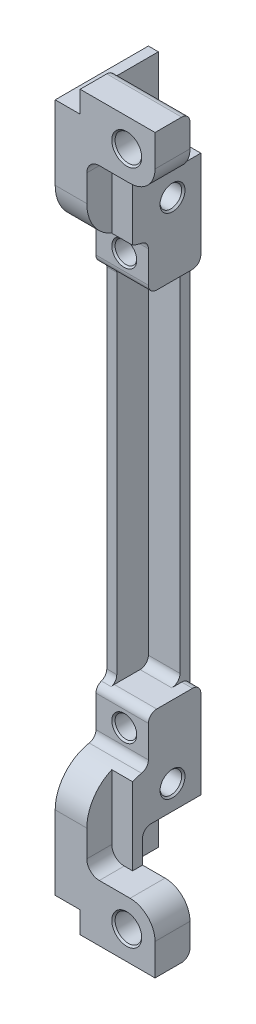
from build123d import *

# Parameters (mm, degrees)
SALIENTE_EXTRUIR1_DEPTH                              = 1.3
SALIENTE_EXTRUIR2_DEPTH                              = 3.8
CORTAR_EXTRUIR1_DEPTH                                = 1.3
SALIENTE_EXTRUIR3_START                              = 1.3
SALIENTE_EXTRUIR3_DEPTH                              = 1.3
CROQUIS14_W                                          = 5.1
CROQUIS14_H                                          = 11.2
SALIENTE_EXTRUIR4_DEPTH                              = 8.901695159
CROQUIS15_W                                          = 5.1
CROQUIS15_H                                          = 11.2
SALIENTE_EXTRUIR5_DEPTH                              = 8.901695176
CROQUIS22_W                                          = 3.8
CROQUIS22_H                                          = 43.6
CORTAR_EXTRUIR2_DEPTH                                = 0.3
SALIENTE_EXTRUIR6_DEPTH                              = 1.2
CROQUIS31_W                                          = 4.2
CROQUIS31_H                                          = 5.4
SALIENTE_EXTRUIR7_DEPTH                              = 3.5
CROQUIS32_W                                          = 7
CROQUIS32_H                                          = 8
CORTAR_EXTRUIR3_DEPTH                                = 5.1
CROQUIS41_W                                          = 6.8
CROQUIS41_H                                          = 4.2
SALIENTE_EXTRUIR8_DEPTH                              = 1.4
CROQUIS42_W                                          = 3.3
CROQUIS42_H                                          = 4.2
SALIENTE_EXTRUIR9_DEPTH                              = 2.6
CROQUIS43_W                                          = 5.1
CROQUIS43_H                                          = 7
CORTAR_EXTRUIR4_DEPTH                                = 8
CROQUIS48_W                                          = 4.2
CROQUIS48_H                                          = 6.8
SALIENTE_EXTRUIR10_DEPTH                             = 5.7
CORTAR_EXTRUIR5_REACH                                = 87.637
CROQUIS58_W                                          = 3.8
CROQUIS58_H                                          = 43.6
CORTAR_EXTRUIR6_REACH                                = 83.667
CROQUIS80_W                                          = 2.5
CROQUIS80_H                                          = 3
CORTAR_EXTRUIR7_REACH                                = 83.667
CROQUIS93_W                                          = 2.5
CROQUIS93_H                                          = 3
AVELLANADO_PARA_TORNILLO_CON_CABEZA_PLAN_D           = 3.8
AVELLANADO_PARA_TORNILLO_CON_CABEZA_PLAN_DEPTH       = 12
AVELLANADO_PARA_TORNILLO_CON_CABEZA_PLAN_CSINK_D     = 5.800283413
AVELLANADO_PARA_TORNILLO_CON_CABEZA_PLAN_CSINK_ANGLE = 90.0028
TALADRO_DE_MARGEN_PARA_21_D                          = 2.6
TALADRO_DE_MARGEN_PARA_22_D                          = 2.6
TALADRO_DE_MARGEN_PARA_22_DEPTH                      = 11.2
TALADRO_DE_MARGEN_PARA_23_D                          = 2.6
AVELLANADO_PARA_TORNILLO_CON_CABEZA_2_D              = 3.2
AVELLANADO_PARA_TORNILLO_CON_CABEZA_2_CSINK_D        = 6.600114174
AVELLANADO_PARA_TORNILLO_CON_CABEZA_2_CSINK_ANGLE    = 90.000991
REDONDEO1_R                                          = 3
CHAFL_N1_SIZE2                                       = 0.19999984
CHAFL_N1_SIZE                                        = 0.199999815
CORTAR_EXTRUIR8_OUTLINE_R                            = 1.3
CORTAR_EXTRUIR8_OUTLINE_R_2                          = 1.9
CORTAR_EXTRUIR8_DEPTH                                = 13
CORTAR_EXTRUIR8_START                                = 5
CORTAR_EXTRUIR8_2_DEPTH                              = 1.3
CORTAR_EXTRUIR8_3_DEPTH                              = 5
CORTAR_EXTRUIR8_4_DEPTH                              = 1.3
CORTAR_EXTRUIR8_START_2                              = 7
CORTAR_EXTRUIR8_5_DEPTH                              = 4.2


with BuildPart() as part:
    # Croquis1 → Saliente-Extruir1 (new body)
    with BuildSketch(Plane(origin=(6.3, 0, 0), x_dir=(0, 0, -1), z_dir=(1, 0, 0))):
        with BuildLine():
            Line((-11.2, 8.901695159), (0, 8.901695159))
            Line((0, 8.901695159), (0, 73.898304841))
            Line((0, 73.898304841), (-11.2, 73.898304841))
            ThreePointArc((-11.2, 73.898304841), (-9.770714214, 70.398304841), (-6.3, 68.899304941))
            Line((-6.3, 68.899304941), (-6.3, 64.2))
            ThreePointArc((-6.3, 64.2), (-6.007106781, 63.492893219), (-5.3, 63.2))
            Line((-5.3, 63.2), (-5.3, 19.6))
            ThreePointArc((-5.3, 19.6), (-6.007106781, 19.307106781), (-6.3, 18.6))
            Line((-6.3, 18.6), (-6.3, 13.900695059))
            ThreePointArc((-6.3, 13.900695059), (-9.770714214, 12.401695159), (-11.2, 8.901695159))
        make_face()
    extrude(amount=-SALIENTE_EXTRUIR1_DEPTH)

    # Croquis6 → Saliente-Extruir2 (add)
    with BuildSketch(Plane.ZY.offset(-5)):
        with BuildLine():
            Line((0, 73.898304841), (11.2, 73.898304841))
            ThreePointArc((11.2, 73.898304841), (9.770714214, 70.398304841), (6.3, 68.899304941))
            Line((6.3, 68.899304941), (6.3, 64.2))
            ThreePointArc((6.3, 64.2), (6.007106781, 63.492893219), (5.3, 63.2))
            Line((5.3, 63.2), (5.3, 19.6))
            ThreePointArc((5.3, 19.6), (6.007106781, 19.307106781), (6.3, 18.6))
            Line((6.3, 18.6), (6.3, 13.900695059))
            ThreePointArc((6.3, 13.900695059), (9.770714214, 12.401695159), (11.2, 8.901695159))
            Line((11.2, 8.901695159), (0, 8.901695159))
            Line((0, 8.901695159), (0, 73.898304841))
        make_face()
    extrude(amount=SALIENTE_EXTRUIR2_DEPTH)

    # Croquis7 → Cortar-Extruir1 (cut)
    with BuildSketch(Plane(origin=(6.3, 0, 0), x_dir=(0, 0, -1), z_dir=(1, 0, 0))):
        with BuildLine():
            Line((-5.3, 19.6), (0, 19.6))
            Line((0, 19.6), (0, 73.898304841))
            Line((0, 73.898304841), (-11.2, 73.898304841))
            ThreePointArc((-11.2, 73.898304841), (-9.770714214, 70.398304841), (-6.3, 68.899304941))
            Line((-6.3, 68.899304941), (-6.3, 64.2))
            ThreePointArc((-6.3, 64.2), (-6.007106781, 63.492893219), (-5.3, 63.2))
            Line((-5.3, 63.2), (-5.3, 19.6))
        make_face()
    extrude(amount=-CORTAR_EXTRUIR1_DEPTH, mode=Mode.SUBTRACT)

    # Croquis8 → Saliente-Extruir3 (add)
    with BuildSketch(Plane(origin=(5, 0, 0), x_dir=(0, 0, -1), z_dir=(1, 0, 0)).offset(SALIENTE_EXTRUIR3_START)):
        with BuildLine():
            Line((0, 73.898304841), (0, 63.2))
            Line((0, 63.2), (-5.3, 63.2))
            ThreePointArc((-5.3, 63.2), (-6.007106781, 63.492893219), (-6.3, 64.2))
            Line((-6.3, 64.2), (-6.3, 68.899304941))
            ThreePointArc((-6.3, 68.899304941), (-9.770714214, 70.398304841), (-11.2, 73.898304841))
            Line((-11.2, 73.898304841), (0, 73.898304841))
        make_face()
    extrude(amount=-SALIENTE_EXTRUIR3_DEPTH)

    # Croquis14 → Saliente-Extruir4 (add)
    with BuildSketch(Plane(origin=(0, 73.898304841, 0), x_dir=(1, 0, 0), z_dir=(0, 1, 0))):
        with Locations((3.75, -5.6)):
            Rectangle(CROQUIS14_W, CROQUIS14_H)
    extrude(amount=SALIENTE_EXTRUIR4_DEPTH)

    # Croquis15 → Saliente-Extruir5 (add)
    with BuildSketch(Plane.XZ.offset(-8.901695159)):
        with Locations((3.75, 5.6)):
            Rectangle(CROQUIS15_W, CROQUIS15_H)
    extrude(amount=SALIENTE_EXTRUIR5_DEPTH)

    # Croquis22 → Cortar-Extruir2 (cut)
    with BuildSketch(Plane.XY.offset(5.3)):
        with Locations((3.1, 41.4)):
            Rectangle(CROQUIS22_W, CROQUIS22_H)
    extrude(amount=-CORTAR_EXTRUIR2_DEPTH, mode=Mode.SUBTRACT)

    # Croquis30 → Saliente-Extruir6 (add)
    with BuildSketch(Plane.ZY.offset(-1.2)):
        with BuildLine():
            Line((6.3, 68.899304941), (6.3, 64.2))
            ThreePointArc((6.3, 64.2), (6.121583836, 63.629912287), (5.65, 63.2632503))
            ThreePointArc((5.65, 63.2632503), (5.178416164, 62.896588313), (5, 62.3265006))
            Line((5, 62.3265006), (5, 20.4734994))
            ThreePointArc((5, 20.4734994), (5.178416164, 19.903411687), (5.65, 19.5367497))
            ThreePointArc((5.65, 19.5367497), (6.121583836, 19.170087713), (6.3, 18.6))
            Line((6.3, 18.6), (6.3, 13.900695059))
            ThreePointArc((6.3, 13.900695059), (9.770714214, 12.401695159), (11.2, 8.901695159))
            Line((11.2, 8.901695159), (11.2, 0))
            Line((11.2, 0), (0, 0))
            Line((0, 0), (0, 82.8))
            Line((0, 82.8), (11.2, 82.8))
            Line((11.2, 82.8), (11.2, 73.898304841))
            ThreePointArc((11.2, 73.898304841), (9.770714214, 70.398304841), (6.3, 68.899304941))
        make_face()
    extrude(amount=SALIENTE_EXTRUIR6_DEPTH)

    # Croquis31 → Saliente-Extruir7 (add)
    with BuildSketch(Plane(origin=(6.3, 0, 0), x_dir=(0, 0, -1), z_dir=(1, 0, 0))):
        with Locations((-9.1, 80.1)):
            Rectangle(CROQUIS31_W, CROQUIS31_H)
    extrude(amount=SALIENTE_EXTRUIR7_DEPTH)

    # Croquis32 → Cortar-Extruir3 (cut)
    with BuildSketch(Plane(origin=(6.3, 0, 0), x_dir=(0, 0, -1), z_dir=(1, 0, 0))):
        with Locations((-3.5, 78.8)):
            Rectangle(CROQUIS32_W, CROQUIS32_H)
    extrude(amount=-CORTAR_EXTRUIR3_DEPTH, mode=Mode.SUBTRACT)

    # Croquis41 → Saliente-Extruir8 (add)
    with BuildSketch(Plane(origin=(0, 82.8, 0), x_dir=(1, 0, 0), z_dir=(0, 1, 0))):
        with Locations((6.4, -9.1)):
            Rectangle(CROQUIS41_W, CROQUIS41_H)
    extrude(amount=SALIENTE_EXTRUIR8_DEPTH)

    # Croquis42 → Saliente-Extruir9 (add)
    with BuildSketch(Plane.XZ):
        with Locations((4.65, 9.1)):
            Rectangle(CROQUIS42_W, CROQUIS42_H)
    extrude(amount=SALIENTE_EXTRUIR9_DEPTH)

    # Croquis43 → Cortar-Extruir4 (cut)
    with BuildSketch(Plane.XZ):
        with Locations((3.75, 3.5)):
            Rectangle(CROQUIS43_W, CROQUIS43_H)
    extrude(amount=-CORTAR_EXTRUIR4_DEPTH, mode=Mode.SUBTRACT)

    # Croquis48 → Saliente-Extruir10 (add)
    with BuildSketch(Plane(origin=(6.3, 0, 0), x_dir=(0, 0, -1), z_dir=(1, 0, 0))):
        with Locations((-9.1, 0.8)):
            Rectangle(CROQUIS48_W, CROQUIS48_H)
    extrude(amount=SALIENTE_EXTRUIR10_DEPTH)

    # Croquis58 → Cortar-Extruir5 (cut, up to next)
    with BuildSketch(Plane(origin=(0, 0, 1.2), x_dir=(-1, 0, 0), z_dir=(0, 0, -1)), mode=Mode.PRIVATE) as cortar_extruir5_sk1:
        with Locations((-3.1, 41.4)):
            Rectangle(CROQUIS58_W, CROQUIS58_H)
    cortar_extruir5_tool1 = extrude(cortar_extruir5_sk1.sketch, amount=-CORTAR_EXTRUIR5_REACH, mode=Mode.PRIVATE) & part.part
    add(cortar_extruir5_tool1.solids().sort_by_distance((3.1, 41.4, 1.2))[0], mode=Mode.SUBTRACT)

    # Croquis80 → Cortar-Extruir6 (cut, up to next)
    with BuildSketch(Plane(origin=(0, 77.4, 0), x_dir=(1, 0, 0), z_dir=(0, 1, 0)), mode=Mode.PRIVATE) as cortar_extruir6_sk1:
        with Locations((5.05, -9.7)):
            Rectangle(CROQUIS80_W, CROQUIS80_H)
    cortar_extruir6_tool1 = extrude(cortar_extruir6_sk1.sketch, amount=-CORTAR_EXTRUIR6_REACH, mode=Mode.PRIVATE) & part.part
    add(cortar_extruir6_tool1.solids().sort_by_distance((5.05, 77.4, 9.7))[0], mode=Mode.SUBTRACT)

    # Croquis93 → Cortar-Extruir7 (cut, up to next)
    with BuildSketch(Plane(origin=(0, 4.2, 0), x_dir=(-1, 0, 0), z_dir=(0, -1, 0)), mode=Mode.PRIVATE) as cortar_extruir7_sk1:
        with Locations((-5.05, -9.7)):
            Rectangle(CROQUIS93_W, CROQUIS93_H)
    cortar_extruir7_tool1 = extrude(cortar_extruir7_sk1.sketch, amount=-CORTAR_EXTRUIR7_REACH, mode=Mode.PRIVATE) & part.part
    add(cortar_extruir7_tool1.solids().sort_by_distance((5.05, 4.2, 9.7))[0], mode=Mode.SUBTRACT)

    # Avellanado para tornillo con cabeza plan
    with Locations(Plane.ZY):
        with Locations((4.1, 3.9), (4.1, 78.9)):
            CounterSinkHole(AVELLANADO_PARA_TORNILLO_CON_CABEZA_PLAN_D / 2, AVELLANADO_PARA_TORNILLO_CON_CABEZA_PLAN_CSINK_D / 2, depth=AVELLANADO_PARA_TORNILLO_CON_CABEZA_PLAN_DEPTH, counter_sink_angle=AVELLANADO_PARA_TORNILLO_CON_CABEZA_PLAN_CSINK_ANGLE)

    # Taladro de margen para #21 (through all)
    with Locations(Plane(origin=(6.3, 0, 0), x_dir=(0, 0, -1), z_dir=(1, 0, 0))):
        with Locations((-3.4, 10.9), (-3.4, 71.9)):
            Hole(TALADRO_DE_MARGEN_PARA_21_D / 2)

    # Taladro de margen para #22
    with Locations(Plane(origin=(0, 0, 0), x_dir=(-1, 0, 0), z_dir=(0, 0, -1))):
        with Locations((-3.4, 66.1)):
            Hole(TALADRO_DE_MARGEN_PARA_22_D / 2, depth=TALADRO_DE_MARGEN_PARA_22_DEPTH)

    # Taladro de margen para #23 (through all)
    with Locations(Plane.XY.offset(6.3)):
        with Locations((3.4, 16.7)):
            Hole(TALADRO_DE_MARGEN_PARA_23_D / 2)

    # Avellanado para tornillo con cabeza  2 (through all)
    with Locations(Plane(origin=(0, 0, 7), x_dir=(-1, 0, 0), z_dir=(0, 0, -1))):
        with Locations((-6.4, 80.8), (-8.6, 0.8)):
            CounterSinkHole(AVELLANADO_PARA_TORNILLO_CON_CABEZA_2_D / 2, AVELLANADO_PARA_TORNILLO_CON_CABEZA_2_CSINK_D / 2, counter_sink_angle=AVELLANADO_PARA_TORNILLO_CON_CABEZA_2_CSINK_ANGLE)

    # Redondeo1
    redondeo1_edges = [part.edges().sort_by_distance(p)[0] for p in [
        (9.8, 77.4, 9.1),
        (12, 4.2, 9.1),
    ]]
    fillet(redondeo1_edges, radius=REDONDEO1_R)

    # Chaflán1
    chafl_n1_edges = [part.edges().sort_by_distance(p)[0] for p in [
        (6.3, 71.9, 2.1),
        (6.3, 10.9, 2.1),
        (2.1, 66.1, 6.3),
        (4.7, 16.7, 6.3),
    ]]
    chamfer(chafl_n1_edges, length=CHAFL_N1_SIZE, length2=CHAFL_N1_SIZE2)

    # Cortar-Extruir8: read off the stored shape, not the designer's step
    # Cortar-Extruir8 outline → Cortar-Extruir8 (cut)
    # profile 1 of 2: a face of its own
    with BuildSketch(Plane.YZ):
        with BuildLine():
            Line((-2.6, 7), (-1.6, 7))
            ThreePointArc((-1.6, 7), (-2.307106781, 7.292893219), (-2.6, 8))
            Line((-2.6, 8), (-2.6, 7))
        make_face()
    # profile 2 of 2: a face of its own
    with BuildSketch(Plane.YZ):
        with BuildLine():
            Line((41.402, 0), (82.8, 0))
            Line((82.8, 0), (82.8, 7))
            Line((82.8, 7), (84.2, 7))
            Line((84.2, 7), (84.2, 11.2))
            Line((84.2, 11.2), (73.898304841, 11.2))
            ThreePointArc((73.898304841, 11.2), (70.398304841, 9.770714214), (68.899304941, 6.3))
            Line((68.899304941, 6.3), (64.2, 6.3))
            ThreePointArc((64.2, 6.3), (63.629912288, 6.121583836), (63.2632503, 5.65))
            ThreePointArc((63.2632503, 5.65), (62.896588313, 5.178416164), (62.3265006, 5))
            Line((62.3265006, 5), (41.402, 5))
            Line((41.402, 5), (41.402, 0))
        make_face()
        with Locations((71.9, 3.4)):
            Circle(CORTAR_EXTRUIR8_OUTLINE_R, mode=Mode.SUBTRACT)
        with Locations((78.9, 4.1)):
            Circle(CORTAR_EXTRUIR8_OUTLINE_R_2, mode=Mode.SUBTRACT)
    extrude(amount=CORTAR_EXTRUIR8_DEPTH, mode=Mode.SUBTRACT)

    # Cortar-Extruir8 2 outline → Cortar-Extruir8 2 (cut)
    with BuildSketch(Plane.YZ.offset(CORTAR_EXTRUIR8_START)):
        with BuildLine():
            Line((19.6, 0), (19.6, 1))
            ThreePointArc((19.6, 1), (19.307106781, 0.292893219), (18.6, 0))
            Line((18.6, 0), (19.6, 0))
        make_face()
    extrude(amount=CORTAR_EXTRUIR8_2_DEPTH, mode=Mode.SUBTRACT)

    # Cortar-Extruir8 3 outline → Cortar-Extruir8 3 (add)
    with BuildSketch(Plane.YZ):
        with BuildLine():
            ThreePointArc((14.8, 6.3), (14.16099035, 6.530801283), (13.816949193, 7.116666667))
            ThreePointArc((13.816949193, 7.116666667), (13.875611511, 6.710055017), (13.900695059, 6.3))
            Line((13.900695059, 6.3), (14.8, 6.3))
        make_face()
        with BuildLine():
            ThreePointArc((7, 7), (7.707106781, 6.707106781), (8, 6))
            Line((8, 6), (8, 7))
            Line((8, 7), (7, 7))
        make_face()
        with BuildLine():
            Line((19.6, 2.2), (19.6, 1.2))
            Line((19.6, 1.2), (20.6, 1.2))
            ThreePointArc((20.6, 1.2), (19.892893219, 1.492893219), (19.6, 2.2))
        make_face()
    extrude(amount=CORTAR_EXTRUIR8_3_DEPTH)

    # Cortar-Extruir8 4 outline → Cortar-Extruir8 4 (add)
    with BuildSketch(Plane.YZ.offset(CORTAR_EXTRUIR8_START)):
        with BuildLine():
            ThreePointArc((14.8, 6.3), (14.16099035, 6.530801283), (13.816949193, 7.116666667))
            ThreePointArc((13.816949193, 7.116666667), (13.875611511, 6.710055017), (13.900695059, 6.3))
            Line((13.900695059, 6.3), (14.8, 6.3))
        make_face()
        with BuildLine():
            ThreePointArc((7, 7), (7.707106781, 6.707106781), (8, 6))
            Line((8, 6), (8, 7))
            Line((8, 7), (7, 7))
        make_face()
    extrude(amount=CORTAR_EXTRUIR8_4_DEPTH)

    # Cortar-Extruir8 5 outline → Cortar-Extruir8 5 (add)
    with BuildSketch(Plane.XY.offset(CORTAR_EXTRUIR8_START_2)):
        with BuildLine():
            ThreePointArc((5.3, 4.2), (4.239339828, 4.639339828), (3.8, 5.7))
            Line((3.8, 5.7), (3.8, 4.2))
            Line((3.8, 4.2), (5.3, 4.2))
        make_face()
    extrude(amount=CORTAR_EXTRUIR8_5_DEPTH)

    # Cortar-Extruir8 6 outline → Cortar-Extruir8 6 (revolve, cut)
    with BuildSketch(Plane(origin=(3.4, 16.7, 0), x_dir=(1, 0, 0), z_dir=(0, -1, 0))):
        Polygon((2.30016099, 0), (1.3, 1.000284865), (1.3, 0), align=None)
    revolve(axis=Axis((3.4, 16.7, 0), (0, 0, 1)), mode=Mode.SUBTRACT)

    # Cortar-Extruir8 7 outline → Cortar-Extruir8 7 (revolve, cut)
    with BuildSketch(Plane(origin=(0, 10.9, 3.4), x_dir=(0, 1, 0), z_dir=(0, 0, -1))):
        Polygon((2.30016099, 0), (1.3, 1.000284865), (1.3, 0), align=None)
    revolve(axis=Axis((0, 10.9, 3.4), (1, 0, 0)), mode=Mode.SUBTRACT)

    # Cortar-Extruir8 8 outline → Cortar-Extruir8 8 (revolve, cut)
    with BuildSketch(Plane(origin=(8.6, 0.8, 0), x_dir=(1, 0, 0), z_dir=(0, -1, 0))):
        Polygon((1.6, 11.2), (1.6, 11.000129523), (1.799854298, 11.2), align=None)
    revolve(axis=Axis((8.6, 0.8, 0), (0, 0, 1)), mode=Mode.SUBTRACT)

    # Simetría1: part across plane


with BuildPart() as part_1:
    add(part.part)
    add(part.part.mirror(Plane.ZX.offset(41.402)))


solid = part_1.part
